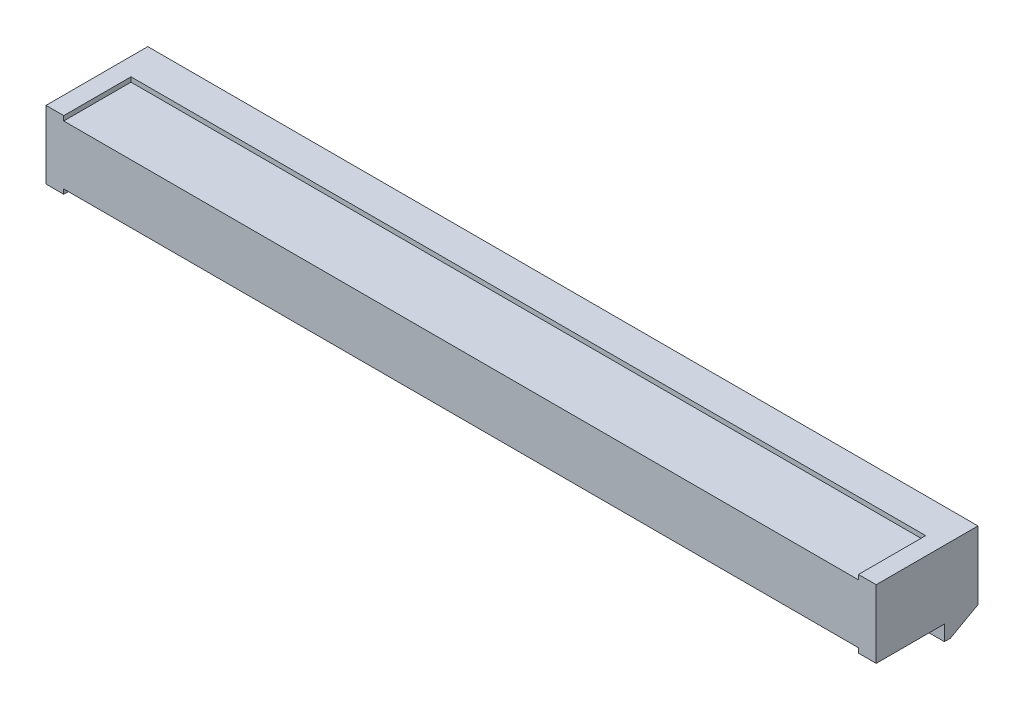
from build123d import *

# Parameters (mm, degrees)
SKETCH1_W           = 88.9
SKETCH1_H           = 10.9
BOSS_EXTRUDE1_DEPTH = 3.65
SKETCH2_W           = 85.1
SKETCH2_H           = 7.2
CUT_EXTRUDE1_DEPTH  = 0.5
SKETCH3_W           = 11.7
SKETCH3_H           = 0.85
SKETCH3_W_2         = 71.7
CUT_EXTRUDE2_DEPTH  = 7.82
CHAMFER1_SIZE       = 0.3
SKETCH4_W           = 1.2
SKETCH4_H           = 1.2
CUT_EXTRUDE3_DEPTH  = 7.82
SKETCH5_W           = 0.5
SKETCH5_H           = 1.37
CUT_EXTRUDE4_DEPTH  = 7.82
LPATTERN1_COUNT     = 84
LPATTERN1_PITCH     = 1
BOSS_EXTRUDE2_DEPTH = 88.9
SKETCH7_W           = 1.27
SKETCH7_H           = 1.637455432
CUT_EXTRUDE5_DEPTH  = 47.071354277
LPATTERN3_COUNT     = 17
LPATTERN3_PITCH     = 5


with BuildPart() as part:
    # Sketch1 → Boss-Extrude1 (new body)
    with BuildSketch(Plane(origin=(0, 0, 0), x_dir=(1, 0, 0), z_dir=(0, 1, 0))):
        Rectangle(SKETCH1_W, SKETCH1_H)
    extrude(amount=BOSS_EXTRUDE1_DEPTH)

    # Sketch2 → Cut-Extrude1 (cut)
    with BuildSketch(Plane(origin=(0, 3.65, 0), x_dir=(1, 0, 0), z_dir=(0, 1, 0))):
        with Locations((0, -1.85)):
            Rectangle(SKETCH2_W, SKETCH2_H)
    extrude(amount=-CUT_EXTRUDE1_DEPTH, mode=Mode.SUBTRACT)

    # Sketch3 → Cut-Extrude2 (cut)
    with BuildSketch(Plane(origin=(0, 0, -5.45), x_dir=(-1, 0, 0), z_dir=(0, 0, -1))):
        with Locations((-36.7, 0.425)):
            Rectangle(SKETCH3_W, SKETCH3_H)
        with Locations((6.7, 0.425)):
            Rectangle(SKETCH3_W_2, SKETCH3_H)
    extrude(amount=-CUT_EXTRUDE2_DEPTH, mode=Mode.SUBTRACT)

    # Chamfer1
    chamfer1_edges = [part.edges().sort_by_distance(p)[0] for p in [
        (30.85, 0.425, -5.45),
        (29.15, 0.425, -5.45),
    ]]
    chamfer(chamfer1_edges, length=CHAMFER1_SIZE)

    # Sketch4 → Cut-Extrude3 (cut)
    with BuildSketch(Plane(origin=(0, 0, -5.45), x_dir=(-1, 0, 0), z_dir=(0, 0, -1))):
        with Locations((-43.01, 2.28)):
            Rectangle(SKETCH4_W, SKETCH4_H)
        with Locations((-30, 2.28)):
            Rectangle(SKETCH4_W, SKETCH4_H)
        with Locations((43.01, 2.28)):
            Rectangle(SKETCH4_W, SKETCH4_H)
    extrude(amount=-CUT_EXTRUDE3_DEPTH, mode=Mode.SUBTRACT)

    # Sketch5 → Cut-Extrude4 (cut)
    with BuildSketch(Plane(origin=(0, 0, -5.45), x_dir=(-1, 0, 0), z_dir=(0, 0, -1))):
        with Locations((-41.66, 2.225)):
            Rectangle(SKETCH5_W, SKETCH5_H)
    cut_extrude4 = extrude(amount=-CUT_EXTRUDE4_DEPTH, mode=Mode.SUBTRACT)

    # LPattern1: Cut-Extrude4 ×84, 2 skipped
    with Locations(*[(-i * LPATTERN1_PITCH, 0, 0) for i in range(1, LPATTERN1_COUNT) if i not in (11, 12)]):
        add(cut_extrude4, mode=Mode.SUBTRACT)

    # Mirror1: part across plane


with BuildPart() as part_1:
    add(part.part)
    add(part.part.mirror(Plane(origin=(0, 0, 0), x_dir=(0, 0, 1), z_dir=(0, -1, 0))))

    # Sketch6 → Boss-Extrude2 (add)
    with BuildSketch(Plane(origin=(44.45, 0, 0), x_dir=(0, 0, -1), z_dir=(1, 0, 0))):
        Polygon((5.45, -3.65), (2.502580222, -5.287455432), (1.85, -5.287455432), (1.85, -3.65), align=None)
    extrude(amount=-BOSS_EXTRUDE2_DEPTH)

    # Sketch7 → Cut-Extrude5 (cut, through all)
    with BuildSketch(Plane(origin=(0, 0, -5.45), x_dir=(-1, 0, 0), z_dir=(0, 0, -1))):
        with Locations((-39.815, -4.468727716)):
            Rectangle(SKETCH7_W, SKETCH7_H)
    cut_extrude5 = extrude(amount=-CUT_EXTRUDE5_DEPTH, mode=Mode.SUBTRACT)

    # LPattern3: Cut-Extrude5 ×17
    with Locations(*[(-i * LPATTERN3_PITCH, 0, 0) for i in range(1, LPATTERN3_COUNT)]):
        add(cut_extrude5, mode=Mode.SUBTRACT)


solid = part_1.part
